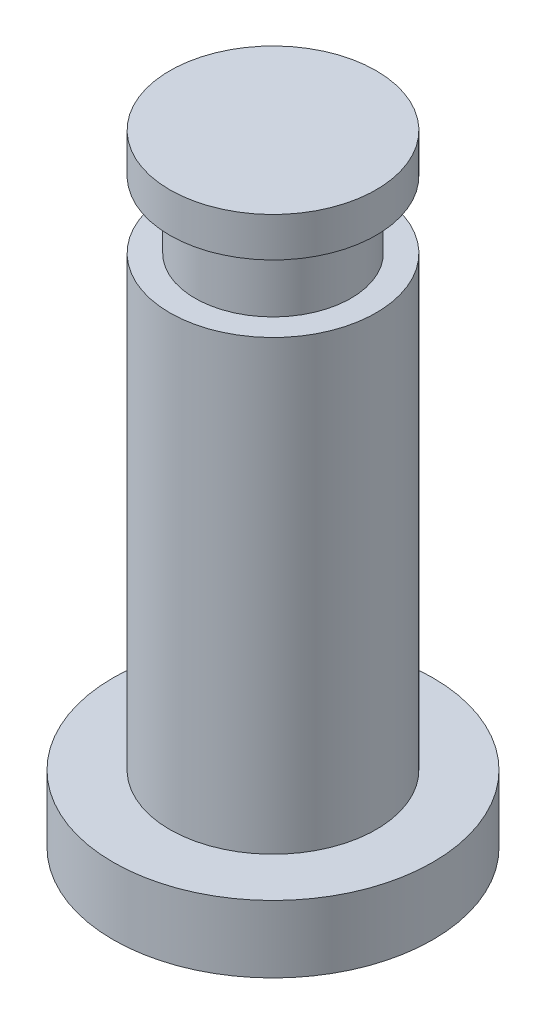
from build123d import *

# Parameters (mm, degrees)
SKETCH1_R           = 6.15
BOSS_EXTRUDE1_DEPTH = 33.02
SKETCH1_4_R         = 9.525
BOSS_EXTRUDE2_DEPTH = 4
SKETCH2_W           = 1.5
SKETCH2_H           = 4


with BuildPart() as part:
    # Sketch1 → Boss-Extrude1 (new body)
    with BuildSketch(Plane(origin=(0, 0, 0), x_dir=(1, 0, 0), z_dir=(0, 1, 0))):
        Circle(SKETCH1_R)
    extrude(amount=BOSS_EXTRUDE1_DEPTH)

    # Sketch1<4> → Boss-Extrude2 (add)
    with BuildSketch(Plane(origin=(0, 0, 0), x_dir=(1, 0, 0), z_dir=(0, 1, 0))):
        Circle(SKETCH1_4_R)
    extrude(amount=-BOSS_EXTRUDE2_DEPTH)

    # Sketch2 → Cut-Revolve1 (revolve, cut)
    with BuildSketch(Plane.XY):
        with Locations((5.4, 28.67)):
            Rectangle(SKETCH2_W, SKETCH2_H)
    revolve(axis=Axis((0, -951.607039238, 0), (0, 1, 0)), mode=Mode.SUBTRACT)


solid = part.part
